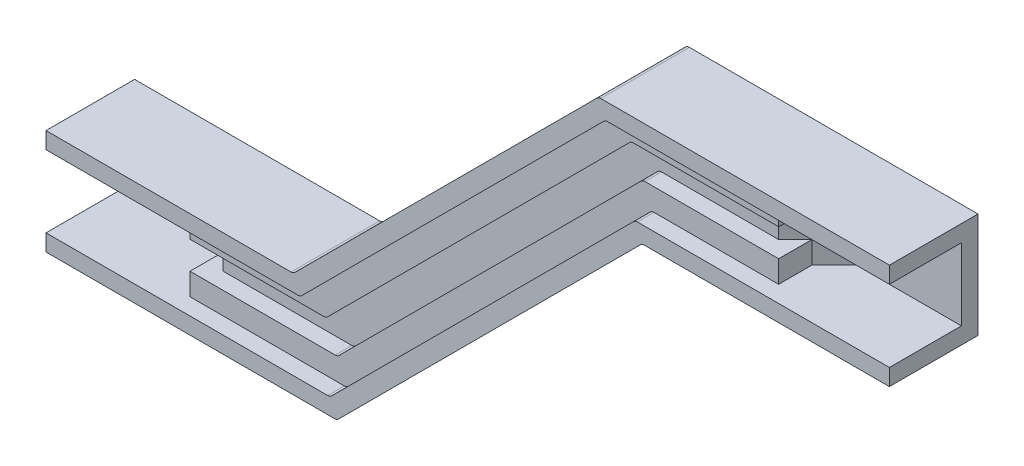
from build123d import *

# Parameters (mm, degrees)
SKETCH_10_R     = 1.65
EXTRUDE_1_DEPTH = 3
EXTRUDE_START   = 3
EXTRUDE_2_DEPTH = 7
EXTRUDE_3_DEPTH = 13
CHAMFER_1_SIZE  = 7
EXTRUDE_5_DEPTH = 10
FILLET_1_R      = 1


with BuildPart() as part:
    # 草图10 → 凸台-拉伸1 (new body)
    with BuildSketch(Plane.XY):
        Polygon((-76.15, -18.05), (-31.485028843, -18.05), (23.614971157, 37.05), (76.15, 37.05), (76.15, 18.05), (31.485028843, 18.05), (-23.614971157, -37.05), (-76.15, -37.05), align=None)
        with Locations((-66.15, -27.55)):
            Circle(SKETCH_10_R, mode=Mode.SUBTRACT)
        with Locations((66.15, 27.55)):
            Circle(SKETCH_10_R, mode=Mode.SUBTRACT)
    extrude(amount=EXTRUDE_1_DEPTH)

    # 草图11 → 凸台-拉伸2 (add)
    with BuildSketch(Plane.XY.offset(EXTRUDE_START)):
        Polygon((-57.15, -18.05), (-57.15, -37.05), (-23.614971157, -37.05), (31.485028843, 18.05), (57.15, 18.05), (57.15, 37.05), (23.614971157, 37.05), (-31.485028843, -18.05), align=None)
    extrude(amount=EXTRUDE_2_DEPTH)

    # 草图12 → 凸台-拉伸3 (add)
    with BuildSketch(Plane.XY.offset(EXTRUDE_START)):
        Polygon((-76.15, -18.05), (-31.485028843, -18.05), (23.614971157, 37.05), (76.15, 37.05), (76.15, 34.05), (24.857611845, 34.05), (-30.242388155, -21.05), (-76.15, -21.05), align=None)
        Polygon((-76.15, -34.05), (-76.15, -37.05), (-23.614971157, -37.05), (31.485028843, 18.05), (76.15, 18.05), (76.15, 21.05), (30.242388155, 21.05), (-24.857611845, -34.05), align=None)
    extrude(amount=EXTRUDE_3_DEPTH)

    # 倒角1
    chamfer_1_edges = [part.edges().sort_by_distance(p)[0] for p in [
        (57.15, 27.55, 10),
        (-57.15, -27.55, 10),
    ]]
    chamfer(chamfer_1_edges, length=CHAMFER_1_SIZE - 0.0001)  # a hair under: the kernel refuses the full size

    # 草图15 → 凸台-拉伸5 (add)
    with BuildSketch(Plane.XY.offset(3)):
        Polygon((-53.15, -21.05), (-53.15, -25.05), (-28.585533906, -25.05), (26.514466094, 30.05), (53.15, 30.05), (53.15, 34.05), (24.857611845, 34.05), (-30.242388155, -21.05), align=None)
        Polygon((-53.15, -30.05), (-53.15, -34.05), (-24.857611845, -34.05), (30.242388155, 21.05), (53.15, 21.05), (53.15, 25.05), (28.585533906, 25.05), (-26.514466094, -30.05), align=None)
    extrude(amount=EXTRUDE_5_DEPTH)

    # 圆角1
    fillet_1_edges = [part.edges().sort_by_distance(p)[0] for p in [
        (-31.485028843, -18.05, 8),
        (23.614971157, 37.05, 8),
        (31.485028843, 18.05, 8),
        (-23.614971157, -37.05, 8),
        (-28.585533906, -25.05, 11.5),
        (26.514466094, 30.05, 11.5),
        (-26.514466094, -30.05, 11.5),
        (28.585533906, 25.05, 11.5),
        (24.857611845, 34.05, 14.5),
        (-30.242388155, -21.05, 14.5),
        (-24.857611845, -34.05, 14.5),
        (30.242388155, 21.05, 14.5),
    ]]
    fillet(fillet_1_edges, radius=FILLET_1_R)


solid = part.part
